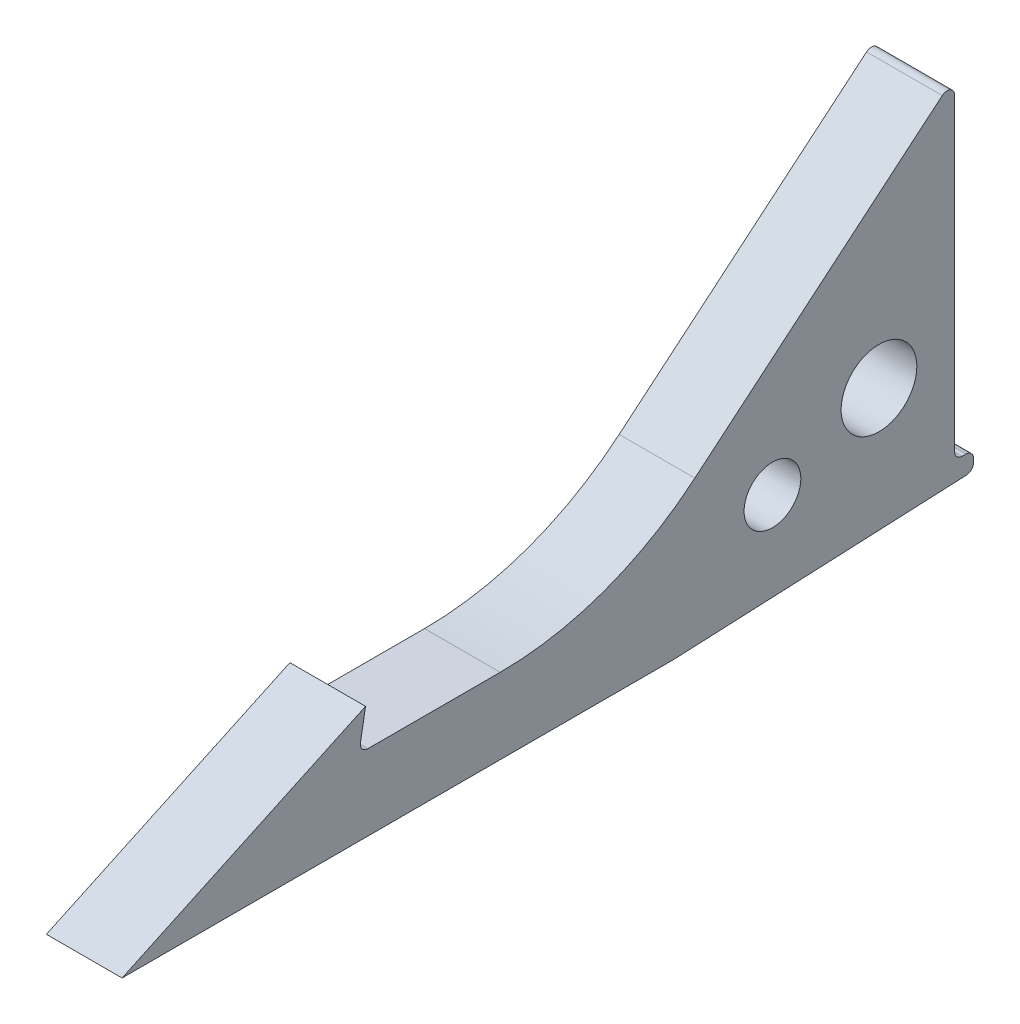
from build123d import *

# Parameters (mm, degrees)
STOCK_BEE_ZERKER_START                       = 9.525
STOCK_BEE_ZERKER_2_0_MULTIBODY_1_OUTLINE_R   = 3.175
STOCK_BEE_ZERKER_2_0_MULTIBODY_1_OUTLINE_R_2 = 2.38125
STOCK_BEE_ZERKER_2_0_MULTIBODY_1_DEPTH       = 6.35
FILLET1_R                                    = 0.635
FILLET2_R                                    = 25.4


# Read off the part's stored shape, not the designer's step: Stock-Bee-zerker 2.0 Multibody-1
with BuildPart() as part:
    # Stock-Bee-zerker 2.0 Multibody-1 outline → Stock-Bee-zerker 2.0 Multibody-1 (new body)
    with BuildSketch(Plane.YZ.offset(STOCK_BEE_ZERKER_START)):
        Polygon((0, 63.5), (1.143, 38.33622), (2.667, 38.33622), (2.667, 39.92372), (30.58384403, 39.92372), (6.35, 68.804490685), (6.35, 89.907129746), (9.525, 89.347291582), (0, 109.77372), align=None)
        with Locations((11.1125, 46.27372)):
            Circle(STOCK_BEE_ZERKER_2_0_MULTIBODY_1_OUTLINE_R, mode=Mode.SUBTRACT)
        with Locations((7.818068754, 55.210853084)):
            Circle(STOCK_BEE_ZERKER_2_0_MULTIBODY_1_OUTLINE_R_2, mode=Mode.SUBTRACT)
    extrude(amount=STOCK_BEE_ZERKER_2_0_MULTIBODY_1_DEPTH)

    # Fillet1
    fillet1_edges = [part.edges().sort_by_distance(p)[0] for p in [
        (12.7, 6.35, 89.907129746),
        (12.7, 30.58384403, 39.92372),
        (12.7, 2.667, 39.92372),
        (12.7, 2.667, 38.33622),
        (12.7, 1.143, 38.33622),
    ]]
    fillet(fillet1_edges, radius=FILLET1_R)

    # Fillet2
    # the kernel refuses this fillet: 25.4 mm, written as the material it adds along each edge
    with BuildSketch(Plane(origin=(9.525, 6.35, 68.804490685), x_dir=(0, 0, 1), z_dir=(1, 0, 0))) as fillet2_piece_1:
        with BuildLine():
            CenterArc((FILLET2_R * 0.363970234267, -FILLET2_R), FILLET2_R, 90, 40)
            Line((-FILLET2_R * 0.278817375421, -FILLET2_R * 0.233955556882), (0, 0))
            Line((0, 0), (FILLET2_R * 0.363970234267, 0))
        make_face()
    extrude(amount=6.35)
    # the kernel refuses this fillet: 25.4 mm, written as the material it takes off along each edge
    with BuildSketch(Plane(origin=(8.083580992, 0, 63.5), x_dir=(0, 0.0453756432593108, -0.9989699950442975), z_dir=(1, 0, 0))) as fillet2_2_piece_1:
        with BuildLine():
            CenterArc((FILLET2_R * 0.0226995119346, FILLET2_R), FILLET2_R, 267.399274167, 2.600725833)
            Line((-FILLET2_R * 0.0226761313248, FILLET2_R * 0.0010300049557), (0, 0))
            Line((0, 0), (FILLET2_R * 0.0226995119345, 0))
        make_face()
    extrude(amount=9.232838016, mode=Mode.SUBTRACT)


solid = part.part
